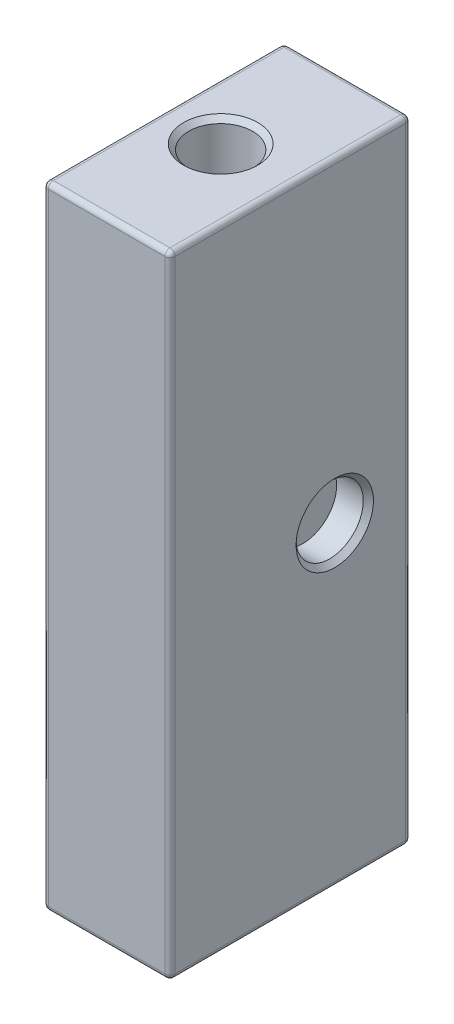
from build123d import *

# Parameters (mm, degrees)
SKETCH1_W           = 10
SKETCH1_H           = 19
SKETCH1_R           = 2.525
BOSS_EXTRUDE1_DEPTH = 24.9
SKETCH2_R           = 2.65
CUT_EXTRUDE1_DEPTH  = 2.5
FILLET1_R           = 0.4
CHAMFER1_SIZE       = 0.4


with BuildPart() as part:
    # Sketch1 → Boss-Extrude1 (new, symmetric)
    with BuildSketch(Plane(origin=(0, 0, 0), x_dir=(1, 0, 0), z_dir=(0, 1, 0))):
        Rectangle(SKETCH1_W, SKETCH1_H)
        with Locations((-0.5, 0)):
            Circle(SKETCH1_R, mode=Mode.SUBTRACT)
    extrude(amount=BOSS_EXTRUDE1_DEPTH, both=True)

    # Sketch2 → Cut-Extrude1 (cut)
    with BuildSketch(Plane(origin=(5, 0, 0), x_dir=(0, 0, -1), z_dir=(1, 0, 0))):
        with Locations((3.5, 0)):
            Circle(SKETCH2_R)
    extrude(amount=-CUT_EXTRUDE1_DEPTH, mode=Mode.SUBTRACT)

    # Fillet1
    fillet1_edges = [part.edges().sort_by_distance(p)[0] for p in [
        (5, 0, -9.5),
        (0, 24.9, -9.5),
        (0, -24.9, -9.5),
        (0, 24.9, 9.5),
        (5, 0, 9.5),
        (0, -24.9, 9.5),
        (-5, 0, -9.5),
        (-5, 24.9, 0),
        (-5, 0, 9.5),
        (-5, -24.9, 0),
        (5, 24.9, 0),
        (5, -24.9, 0),
    ]]
    fillet(fillet1_edges, radius=FILLET1_R)

    # Chamfer1
    chamfer1_edges = [part.edges().sort_by_distance(p)[0] for p in [
        (5, 0, -0.85),
        (-3.025, 24.9, 0),
    ]]
    chamfer(chamfer1_edges, length=CHAMFER1_SIZE)


solid = part.part
